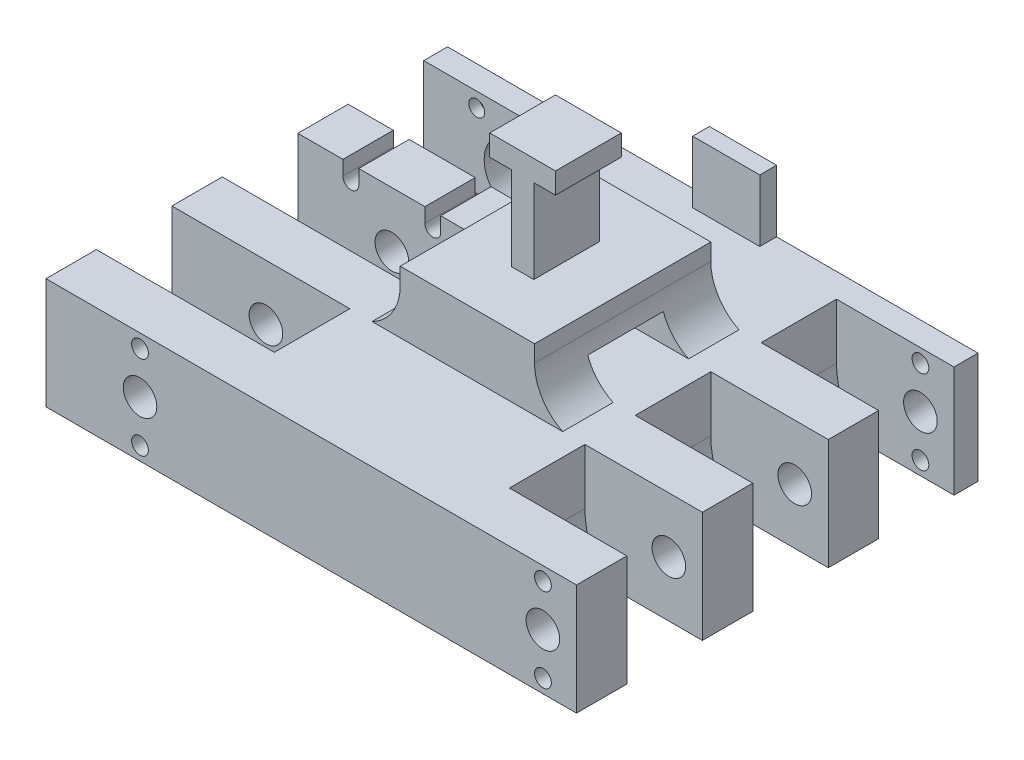
from build123d import *

# Parameters (mm, degrees)
BOSS_EXTRUDE1_DEPTH            = 38.1
CUT_EXTRUDE1_DEPTH             = 164.257993679
CUT_EXTRUDE1_DEPTH_BACK        = 254
SKETCH2_R                      = 6.35
SKETCH12_W                     = 50.8
SKETCH12_H                     = 19.05
BOSS_EXTRUDE6_DEPTH            = 12.7
SKETCH13_W                     = 50.8
SKETCH13_H                     = 66.675
BOSS_EXTRUDE7_DEPTH            = 12.7
SKETCH5_W                      = 8.466666666
SKETCH5_H                      = 24.892
BOSS_EXTRUDE8_DEPTH            = 31.75
SKETCH15_W                     = 24.892
SKETCH15_H                     = 24.892
BOSS_EXTRUDE9_DEPTH            = 7.9375
BOSS_EXTRUDE10_DEPTH           = 9
SKETCH17_3_R                   = 2
CUT_EXTRUDE2_DEPTH             = 206.205484286
SKETCH17_5_R                   = 2.999999969
SKETCH17_5_R_2                 = 2
CUT_EXTRUDE4_DEPTH             = 4
CUT_EXTRUDE4_DIRECTION_2_REACH = 207.205
SKETCH17_6_R                   = 12.7
CUT_EXTRUDE5_DEPTH             = 206.205484286
SKETCH18_W                     = 5.999999938
SKETCH18_H                     = 3.55
CUT_EXTRUDE6_DEPTH             = 19.05
SKETCH19_W                     = 254
SKETCH19_H                     = 38.1
BOSS_EXTRUDE11_DEPTH           = 19.05
SKETCH2_4_R                    = 6.35
CUT_EXTRUDE7_DEPTH             = 195.02247977
FILLET4_R                      = 19.05
CHAMFER1_SIZE                  = 2.032
FILLET1_R                      = 6.35
SKETCH28_W                     = 254
SKETCH28_H                     = 19.05
BOSS_EXTRUDE15_DEPTH           = 1.95
SKETCH30_W                     = 254
SKETCH30_H                     = 19.05
BOSS_EXTRUDE18_DEPTH           = 1.95
SKETCH20_R                     = 3.175
CUT_EXTRUDE8_DEPTH             = 9.525
SKETCH23_W                     = 9.082
SKETCH23_H                     = 42
BOSS_EXTRUDE12_DEPTH           = 101.6
SKETCH22_R                     = 3.175
CUT_EXTRUDE9_DEPTH             = 9.525
SKETCH2_5_R                    = 6.35
CUT_EXTRUDE10_DEPTH            = 104.25
FILLET2_R                      = 6.35
SKETCH25_W                     = 9
SKETCH25_H                     = 42
BOSS_EXTRUDE13_DEPTH           = 29.8
BOSS_EXTRUDE19_REACH           = 212.758
SKETCH32_W                     = 32.300000031
SKETCH32_H                     = 19.05
SKETCH32_W_2                   = 25.000000062
SKETCH32_W_3                   = 13.250000031
SKETCH32_W_4                   = 82.55
BOSS_EXTRUDE20_DEPTH           = 1.95
SKETCH36_W                     = 254
SKETCH36_H                     = 19.05
SKETCH36_W_2                   = 184.700000031
SKETCH36_W_3                   = 32.300000031
SKETCH36_W_4                   = 25.000000062
BOSS_EXTRUDE26_DEPTH           = 1.95
SKETCH37_W                     = 19.05
SKETCH37_H                     = 42
SKETCH37_W_2                   = 9.082
CUT_EXTRUDE11_DEPTH            = 38.1
SKETCH39_W                     = 9
SKETCH39_H                     = 42
SKETCH39_W_2                   = 19.05
CUT_EXTRUDE12_DEPTH            = 15.24
SKETCH40_W                     = 25.4
SKETCH40_H                     = 6.35
BOSS_EXTRUDE27_DEPTH           = 23.45


with BuildPart() as part:
    # Sketch1 → Boss-Extrude1 (new body)
    with BuildSketch(Plane(origin=(0, 0, 0), x_dir=(1, 0, 0), z_dir=(0, 1, 0))):
        Polygon((-25.4, 0), (-25.4, 28.575), (-127, 28.575), (-127, 47.625), (-25.4, 47.625), (-25.4, 76.2), (-127, 76.2), (-127, 95.25), (-25.4, 95.25), (-25.4, 123.825), (25.4, 123.825), (25.4, 95.25), (127, 95.25), (127, 76.2), (25.4, 76.2), (25.4, 47.625), (127, 47.625), (127, 28.575), (25.4, 28.575), (25.4, 0), align=None)
    extrude(amount=BOSS_EXTRUDE1_DEPTH)

    # Sketch2 → Cut-Extrude1 (cut, two sides: drawn at the far end of the back side and taken through both)
    with BuildSketch(Plane.XY.offset(-28.575).offset(-CUT_EXTRUDE1_DEPTH_BACK)):
        with Locations(Location((-76.2, 19.05, 0), (0, 0, 180))):
            Circle(SKETCH2_R)
        with Locations(Location((76.2, 19.05, 0), (0, 0, 180))):
            Circle(SKETCH2_R)
    extrude(amount=CUT_EXTRUDE1_DEPTH + CUT_EXTRUDE1_DEPTH_BACK, mode=Mode.SUBTRACT)

    # Sketch12 → Boss-Extrude6 (add)
    with BuildSketch(Plane(origin=(0, 38.1, 0), x_dir=(1, 0, 0), z_dir=(0, 1, 0))):
        with Locations((0, 38.1)):
            Rectangle(SKETCH12_W, SKETCH12_H)
        with Locations((0, 85.725)):
            Rectangle(SKETCH12_W, SKETCH12_H)
    extrude(amount=BOSS_EXTRUDE6_DEPTH)

    # Sketch13 → Boss-Extrude7 (add)
    with BuildSketch(Plane(origin=(0, 50.8, 0), x_dir=(1, 0, 0), z_dir=(0, 1, 0))):
        with Locations((0, 61.9125)):
            Rectangle(SKETCH13_W, SKETCH13_H)
    extrude(amount=BOSS_EXTRUDE7_DEPTH)

    # Sketch5 → Boss-Extrude8 (add)
    with BuildSketch(Plane(origin=(0, 63.5, 0), x_dir=(1, 0, 0), z_dir=(0, 1, 0))):
        with Locations((0, 61.9125)):
            Rectangle(SKETCH5_W, SKETCH5_H)
    extrude(amount=BOSS_EXTRUDE8_DEPTH)

    # Sketch15 → Boss-Extrude9 (add)
    with BuildSketch(Plane(origin=(0, 95.25, 0), x_dir=(1, 0, 0), z_dir=(0, 1, 0))):
        with Locations((0, 61.9125)):
            Rectangle(SKETCH15_W, SKETCH15_H)
    extrude(amount=BOSS_EXTRUDE9_DEPTH)

    # Sketch17 → Boss-Extrude10 (add)
    with BuildSketch(Plane(origin=(0, 0, -123.825), x_dir=(-1, 0, 0), z_dir=(0, 0, -1))):
        Polygon((55.2, -1.95), (-25.4, -1.95), (-25.4, 40.05), (55.2, 40.05), (97.2, 40.05), (97.2, -1.95), align=None)
    extrude(amount=BOSS_EXTRUDE10_DEPTH)

    # Sketch17<3> → Cut-Extrude2 (cut, through all)
    with BuildSketch(Plane(origin=(0, 0, -123.825), x_dir=(-1, 0, 0), z_dir=(0, 0, -1))):
        with Locations((91.7, 3.55)):
            Circle(SKETCH17_3_R)
        with Locations((60.7, 3.55)):
            Circle(SKETCH17_3_R)
        with Locations((60.7, 34.55)):
            Circle(SKETCH17_3_R)
        with Locations((91.7, 34.55)):
            Circle(SKETCH17_3_R)
    extrude(amount=CUT_EXTRUDE2_DEPTH, mode=Mode.SUBTRACT)

    # Sketch17<5> → Cut-Extrude4 (cut)
    # profile 1 of 4: a face of its own
    with BuildSketch(Plane(origin=(0, 0, -123.825), x_dir=(-1, 0, 0), z_dir=(0, 0, -1))):
        with Locations((91.7, 3.55)):
            Circle(SKETCH17_5_R)
        with Locations((91.7, 3.55)):
            Circle(SKETCH17_5_R_2, mode=Mode.SUBTRACT)
    # profile 2 of 4: a face of its own
    with BuildSketch(Plane(origin=(0, 0, -123.825), x_dir=(-1, 0, 0), z_dir=(0, 0, -1))):
        with Locations((91.7, 34.55)):
            Circle(SKETCH17_5_R)
    # profile 3 of 4: a face of its own
    with BuildSketch(Plane(origin=(0, 0, -123.825), x_dir=(-1, 0, 0), z_dir=(0, 0, -1))):
        with Locations((60.7, 34.55)):
            Circle(SKETCH17_5_R)
    # profile 4 of 4: a face of its own
    with BuildSketch(Plane(origin=(0, 0, -123.825), x_dir=(-1, 0, 0), z_dir=(0, 0, -1))):
        with Locations((60.7, 3.55)):
            Circle(SKETCH17_5_R)
    extrude(amount=CUT_EXTRUDE4_DEPTH, mode=Mode.SUBTRACT)

    # Cut-Extrude4 direction 2: up to this face of the body (flat: up to its plane)
    cut_extrude4_direction_2_end = Plane(part.part.faces().sort_by_distance((-26.485088476, 19.05, -76.2))[0])
    # Sketch17<5> → Cut-Extrude4 direction 2 (cut, up to the picked face)
    with BuildSketch(Plane(origin=(0, 0, -123.825), x_dir=(-1, 0, 0), z_dir=(0, 0, -1)), mode=Mode.PRIVATE) as cut_extrude4_direction_2_sk1:
        with Locations((91.7, 3.55)):
            Circle(SKETCH17_5_R)
        with Locations((91.7, 3.55)):
            Circle(SKETCH17_5_R_2, mode=Mode.SUBTRACT)
    cut_extrude4_direction_2_tool1 = split(extrude(cut_extrude4_direction_2_sk1.sketch, amount=-CUT_EXTRUDE4_DIRECTION_2_REACH, mode=Mode.PRIVATE), bisect_by=cut_extrude4_direction_2_end, keep=Keep.BOTH, mode=Mode.PRIVATE)
    # Sketch17<5> → Cut-Extrude4 direction 2 (cut, up to the picked face)
    with BuildSketch(Plane(origin=(0, 0, -123.825), x_dir=(-1, 0, 0), z_dir=(0, 0, -1)), mode=Mode.PRIVATE) as cut_extrude4_direction_2_sk2:
        with Locations((91.7, 34.55)):
            Circle(SKETCH17_5_R)
    cut_extrude4_direction_2_tool2 = split(extrude(cut_extrude4_direction_2_sk2.sketch, amount=-CUT_EXTRUDE4_DIRECTION_2_REACH, mode=Mode.PRIVATE), bisect_by=cut_extrude4_direction_2_end, keep=Keep.BOTH, mode=Mode.PRIVATE)
    # Sketch17<5> → Cut-Extrude4 direction 2 (cut, up to the picked face)
    with BuildSketch(Plane(origin=(0, 0, -123.825), x_dir=(-1, 0, 0), z_dir=(0, 0, -1)), mode=Mode.PRIVATE) as cut_extrude4_direction_2_sk3:
        with Locations((60.7, 34.55)):
            Circle(SKETCH17_5_R)
    cut_extrude4_direction_2_tool3 = split(extrude(cut_extrude4_direction_2_sk3.sketch, amount=-CUT_EXTRUDE4_DIRECTION_2_REACH, mode=Mode.PRIVATE), bisect_by=cut_extrude4_direction_2_end, keep=Keep.BOTH, mode=Mode.PRIVATE)
    # Sketch17<5> → Cut-Extrude4 direction 2 (cut, up to the picked face)
    with BuildSketch(Plane(origin=(0, 0, -123.825), x_dir=(-1, 0, 0), z_dir=(0, 0, -1)), mode=Mode.PRIVATE) as cut_extrude4_direction_2_sk4:
        with Locations((60.7, 3.55)):
            Circle(SKETCH17_5_R)
    cut_extrude4_direction_2_tool4 = split(extrude(cut_extrude4_direction_2_sk4.sketch, amount=-CUT_EXTRUDE4_DIRECTION_2_REACH, mode=Mode.PRIVATE), bisect_by=cut_extrude4_direction_2_end, keep=Keep.BOTH, mode=Mode.PRIVATE)
    add(cut_extrude4_direction_2_tool1.solids().sort_by(Axis((-88.784853, 3.55, -123.825), (0, 0, 1)))[0], mode=Mode.SUBTRACT)
    add(cut_extrude4_direction_2_tool2.solids().sort_by(Axis((-91.7, 34.55, -123.825), (0, 0, 1)))[0], mode=Mode.SUBTRACT)
    add(cut_extrude4_direction_2_tool3.solids().sort_by(Axis((-60.7, 34.55, -123.825), (0, 0, 1)))[0], mode=Mode.SUBTRACT)
    add(cut_extrude4_direction_2_tool4.solids().sort_by(Axis((-60.7, 3.55, -123.825), (0, 0, 1)))[0], mode=Mode.SUBTRACT)


with BuildPart() as cut_extrude4_kept_piece:
    # of the separate pieces the step leaves, the one the design keeps (cut_extrude4_pieces_kept)
    add(part.part.solids().sort_by_distance((25.4, -1.95, -123.825))[0])

    # Sketch17<6> → Cut-Extrude5 (cut, through all)
    with BuildSketch(Plane(origin=(0, 0, -123.825), x_dir=(-1, 0, 0), z_dir=(0, 0, -1))):
        with Locations((76.2, 19.05)):
            Circle(SKETCH17_6_R)
    extrude(amount=CUT_EXTRUDE5_DEPTH, mode=Mode.SUBTRACT)

    # Sketch18 → Cut-Extrude6 (cut)
    with BuildSketch(Plane.XY.offset(-76.2)):
        with Locations((-91.7, 36.325)):
            Rectangle(SKETCH18_W, SKETCH18_H)
        with Locations((-60.7, 36.325)):
            Rectangle(SKETCH18_W, SKETCH18_H)
        with Locations((-91.7, 1.775)):
            Rectangle(SKETCH18_W, SKETCH18_H)
        with Locations((-60.7, 1.775)):
            Rectangle(SKETCH18_W, SKETCH18_H)
    extrude(amount=-CUT_EXTRUDE6_DEPTH, mode=Mode.SUBTRACT)

    # Sketch19 → Boss-Extrude11 (add)
    with BuildSketch(Plane.XY):
        with Locations((0, 19.05)):
            Rectangle(SKETCH19_W, SKETCH19_H)
    extrude(amount=BOSS_EXTRUDE11_DEPTH)

    # Sketch2<4> → Cut-Extrude7 (cut, through all)
    with BuildSketch(Plane.XY.offset(-28.575)):
        with Locations(Location((-76.2, 19.05, 0), (0, 0, 180))):
            Circle(SKETCH2_4_R)
        with Locations(Location((76.2, 19.05, 0), (0, 0, 180))):
            Circle(SKETCH2_4_R)
    extrude(amount=CUT_EXTRUDE7_DEPTH, mode=Mode.SUBTRACT)

    # Fillet4
    # the kernel refuses this fillet: 19.05 mm, written as the material it adds along each edge
    with BuildSketch(Plane(origin=(25.4, 38.1, -95.25), x_dir=(0, 1, 0), z_dir=(0, 0, 1))) as fillet4_piece_1_section:
        with BuildLine():
            CenterArc((FILLET4_R, -FILLET4_R), FILLET4_R, 90, 90)
            Line((0, -FILLET4_R), (0, 0))
            Line((0, 0), (FILLET4_R, 0))
        make_face()
    fillet4_piece_1 = extrude(amount=66.675, mode=Mode.PRIVATE)
    fillet4_piece_1 = split(fillet4_piece_1, bisect_by=Plane(origin=(25.459639718, 50.8, -85.725), z_dir=(0, 1, 0)), keep=Keep.TOP, mode=Mode.PRIVATE)
    fillet4_piece_1 = split(fillet4_piece_1, bisect_by=Plane(origin=(25.459639718, 53.200481038, -76.2), z_dir=(0, 0, -1)), keep=Keep.TOP, mode=Mode.PRIVATE)
    add(fillet4_piece_1)
    with BuildSketch(Plane(origin=(25.4, 38.1, -95.25), x_dir=(0, 1, 0), z_dir=(0, 0, 1))) as fillet4_piece_2_section:
        with BuildLine():
            CenterArc((FILLET4_R, -FILLET4_R), FILLET4_R, 90, 90)
            Line((0, -FILLET4_R), (0, 0))
            Line((0, 0), (FILLET4_R, 0))
        make_face()
    fillet4_piece_2 = extrude(amount=66.675, mode=Mode.PRIVATE)
    fillet4_piece_2 = split(fillet4_piece_2, bisect_by=Plane(origin=(29.940315432, 50.8, -85.725), z_dir=(0, -1, 0)), keep=Keep.TOP, mode=Mode.PRIVATE)
    fillet4_piece_2 = split(fillet4_piece_2, bisect_by=Plane(origin=(29.940315432, 41.835832031, -76.2), z_dir=(0, 0, -1)), keep=Keep.TOP, mode=Mode.PRIVATE)
    add(fillet4_piece_2)
    with BuildSketch(Plane(origin=(25.4, 38.1, -95.25), x_dir=(0, 1, 0), z_dir=(0, 0, 1))) as fillet4_piece_3_section:
        with BuildLine():
            CenterArc((FILLET4_R, -FILLET4_R), FILLET4_R, 90, 90)
            Line((0, -FILLET4_R), (0, 0))
            Line((0, 0), (FILLET4_R, 0))
        make_face()
    fillet4_piece_3 = extrude(amount=66.675, mode=Mode.PRIVATE)
    fillet4_piece_3 = split(fillet4_piece_3, bisect_by=Plane(origin=(25.459639718, 53.200481038, -47.625), z_dir=(0, 0, -1)), keep=Keep.TOP, mode=Mode.PRIVATE)
    fillet4_piece_3 = split(fillet4_piece_3, bisect_by=Plane(origin=(25.459639718, 50.8, -61.9125), z_dir=(0, 1, 0)), keep=Keep.TOP, mode=Mode.PRIVATE)
    fillet4_piece_3 = split(fillet4_piece_3, bisect_by=Plane(origin=(25.459639718, 53.200481038, -76.2), z_dir=(0, 0, 1)), keep=Keep.TOP, mode=Mode.PRIVATE)
    add(fillet4_piece_3)
    with BuildSketch(Plane(origin=(25.4, 38.1, -47.625), x_dir=(0, 1, 0), z_dir=(0, 0, 1))) as fillet4_piece_4_section:
        with BuildLine():
            CenterArc((FILLET4_R, -FILLET4_R), FILLET4_R, 90, 90)
            Line((0, -FILLET4_R), (0, 0))
            Line((0, 0), (FILLET4_R, 0))
        make_face()
    fillet4_piece_4 = extrude(amount=19.05, mode=Mode.PRIVATE)
    fillet4_piece_4 = split(fillet4_piece_4, bisect_by=Plane(origin=(25.459639718, 50.8, -38.1), z_dir=(0, 1, 0)), keep=Keep.TOP, mode=Mode.PRIVATE)
    add(fillet4_piece_4)
    with BuildSketch(Plane(origin=(25.4, 38.1, -47.625), x_dir=(0, 1, 0), z_dir=(0, 0, 1))) as fillet4_piece_5_section:
        with BuildLine():
            CenterArc((FILLET4_R, -FILLET4_R), FILLET4_R, 90, 90)
            Line((0, -FILLET4_R), (0, 0))
            Line((0, 0), (FILLET4_R, 0))
        make_face()
    fillet4_piece_5 = extrude(amount=19.05, mode=Mode.PRIVATE)
    fillet4_piece_5 = split(fillet4_piece_5, bisect_by=Plane(origin=(29.940315432, 50.8, -38.1), z_dir=(0, -1, 0)), keep=Keep.TOP, mode=Mode.PRIVATE)
    add(fillet4_piece_5)
    with BuildSketch(Plane(origin=(-25.4, 38.1, -28.575), x_dir=(0, 1, 0), z_dir=(0, 0, -1))) as fillet4_piece_6_section:
        with BuildLine():
            CenterArc((FILLET4_R, -FILLET4_R), FILLET4_R, 90, 90)
            Line((0, -FILLET4_R), (0, 0))
            Line((0, 0), (FILLET4_R, 0))
        make_face()
    fillet4_piece_6 = extrude(amount=66.675, mode=Mode.PRIVATE)
    fillet4_piece_6 = split(fillet4_piece_6, bisect_by=Plane(origin=(-25.459639718, 50.8, -38.1), z_dir=(0, 1, 0)), keep=Keep.TOP, mode=Mode.PRIVATE)
    fillet4_piece_6 = split(fillet4_piece_6, bisect_by=Plane(origin=(-25.459639718, 53.200481038, -47.625), z_dir=(0, 0, 1)), keep=Keep.TOP, mode=Mode.PRIVATE)
    add(fillet4_piece_6)
    with BuildSketch(Plane(origin=(-25.4, 38.1, -28.575), x_dir=(0, 1, 0), z_dir=(0, 0, -1))) as fillet4_piece_7_section:
        with BuildLine():
            CenterArc((FILLET4_R, -FILLET4_R), FILLET4_R, 90, 90)
            Line((0, -FILLET4_R), (0, 0))
            Line((0, 0), (FILLET4_R, 0))
        make_face()
    fillet4_piece_7 = extrude(amount=66.675, mode=Mode.PRIVATE)
    fillet4_piece_7 = split(fillet4_piece_7, bisect_by=Plane(origin=(-29.940315432, 50.8, -38.1), z_dir=(0, -1, 0)), keep=Keep.TOP, mode=Mode.PRIVATE)
    fillet4_piece_7 = split(fillet4_piece_7, bisect_by=Plane(origin=(-29.940315432, 41.835832031, -47.625), z_dir=(0, 0, 1)), keep=Keep.TOP, mode=Mode.PRIVATE)
    add(fillet4_piece_7)
    with BuildSketch(Plane(origin=(-25.4, 38.1, -28.575), x_dir=(0, 1, 0), z_dir=(0, 0, -1))) as fillet4_piece_8_section:
        with BuildLine():
            CenterArc((FILLET4_R, -FILLET4_R), FILLET4_R, 90, 90)
            Line((0, -FILLET4_R), (0, 0))
            Line((0, 0), (FILLET4_R, 0))
        make_face()
    fillet4_piece_8 = extrude(amount=66.675, mode=Mode.PRIVATE)
    fillet4_piece_8 = split(fillet4_piece_8, bisect_by=Plane(origin=(-25.459639718, 53.200481038, -76.2), z_dir=(0, 0, 1)), keep=Keep.TOP, mode=Mode.PRIVATE)
    fillet4_piece_8 = split(fillet4_piece_8, bisect_by=Plane(origin=(-25.459639718, 50.8, -61.9125), z_dir=(0, 1, 0)), keep=Keep.TOP, mode=Mode.PRIVATE)
    fillet4_piece_8 = split(fillet4_piece_8, bisect_by=Plane(origin=(-25.459639718, 53.200481038, -47.625), z_dir=(0, 0, -1)), keep=Keep.TOP, mode=Mode.PRIVATE)
    add(fillet4_piece_8)
    with BuildSketch(Plane(origin=(-25.4, 38.1, -76.2), x_dir=(0, 1, 0), z_dir=(0, 0, -1))) as fillet4_piece_9_section:
        with BuildLine():
            CenterArc((FILLET4_R, -FILLET4_R), FILLET4_R, 90, 90)
            Line((0, -FILLET4_R), (0, 0))
            Line((0, 0), (FILLET4_R, 0))
        make_face()
    fillet4_piece_9 = extrude(amount=19.05, mode=Mode.PRIVATE)
    fillet4_piece_9 = split(fillet4_piece_9, bisect_by=Plane(origin=(-25.459639718, 50.8, -85.725), z_dir=(0, 1, 0)), keep=Keep.TOP, mode=Mode.PRIVATE)
    add(fillet4_piece_9)
    with BuildSketch(Plane(origin=(-25.4, 38.1, -76.2), x_dir=(0, 1, 0), z_dir=(0, 0, -1))) as fillet4_piece_10_section:
        with BuildLine():
            CenterArc((FILLET4_R, -FILLET4_R), FILLET4_R, 90, 90)
            Line((0, -FILLET4_R), (0, 0))
            Line((0, 0), (FILLET4_R, 0))
        make_face()
    fillet4_piece_10 = extrude(amount=19.05, mode=Mode.PRIVATE)
    fillet4_piece_10 = split(fillet4_piece_10, bisect_by=Plane(origin=(-29.940315432, 50.8, -85.725), z_dir=(0, -1, 0)), keep=Keep.TOP, mode=Mode.PRIVATE)
    add(fillet4_piece_10)

    # Chamfer1
    # the kernel refuses this chamfer: 2.032 mm, written as the material it adds along each edge
    with BuildSketch(Plane(origin=(-25.4, 0, -123.825), x_dir=(0, 0.027495876610586417, 0.9996219169112968), z_dir=(1, 0, 0))) as chamfer1_piece_1_section:
        Polygon((CHAMFER1_SIZE * 0.999621916911, CHAMFER1_SIZE * 0.0274958766106), (-CHAMFER1_SIZE * 0.0274958766106, CHAMFER1_SIZE * 0.999621916911), (0, 0), align=None)
    chamfer1_piece_1 = extrude(amount=50.8, mode=Mode.PRIVATE)
    chamfer1_piece_1 = split(chamfer1_piece_1, bisect_by=Plane(origin=(0, -1.95, -123.150310434), z_dir=(0, 1, 0)), keep=Keep.TOP, mode=Mode.PRIVATE)
    add(chamfer1_piece_1)
    with BuildSketch(Plane(origin=(-25.4, 38.1, -123.825), x_dir=(0, -0.027495876610587305, 0.9996219169112968), z_dir=(1, 0, 0))) as chamfer1_piece_2_section:
        Polygon((CHAMFER1_SIZE * 0.999621916911, -CHAMFER1_SIZE * 0.0274958766106), (-CHAMFER1_SIZE * 0.0274958766106, -CHAMFER1_SIZE * 0.999621916911), (0, 0), align=None)
    chamfer1_piece_2 = extrude(amount=50.8, mode=Mode.PRIVATE)
    chamfer1_piece_2 = split(chamfer1_piece_2, bisect_by=Plane(origin=(0, 40.05, -123.150310434), z_dir=(0, -1, 0)), keep=Keep.TOP, mode=Mode.PRIVATE)
    add(chamfer1_piece_2)

    # Fillet1
    fillet1_edges = [cut_extrude4_kept_piece.edges().sort_by_distance(p)[0] for p in [
        (-25.4, 19.05, -123.825),
    ]]
    fillet(fillet1_edges, radius=FILLET1_R)

    # Sketch28 → Boss-Extrude15 (add)
    with BuildSketch(Plane(origin=(0, 38.1, 0), x_dir=(1, 0, 0), z_dir=(0, 1, 0))):
        with Locations((0, -9.525)):
            Rectangle(SKETCH28_W, SKETCH28_H)
    extrude(amount=BOSS_EXTRUDE15_DEPTH)

    # Sketch30 → Boss-Extrude18 (add)
    with BuildSketch(Plane.XZ):
        with Locations((0, 9.525)):
            Rectangle(SKETCH30_W, SKETCH30_H)
    extrude(amount=BOSS_EXTRUDE18_DEPTH)

    # Sketch20 → Cut-Extrude8 (cut)
    with BuildSketch(Plane.XY.offset(19.05)):
        with Locations((76.2, 3.175)):
            Circle(SKETCH20_R)
        with Locations((76.2, 34.925)):
            Circle(SKETCH20_R)
    cut_extrude8 = extrude(amount=-CUT_EXTRUDE8_DEPTH, mode=Mode.SUBTRACT)

    # Mirror1: Cut-Extrude8 across plane
    add(cut_extrude8.mirror(Plane(origin=(0, 0, 0), x_dir=(0, 0, 1), z_dir=(1, 0, 0))), mode=Mode.SUBTRACT)

    # Sketch23 → Boss-Extrude12 (add)
    with BuildSketch(Plane(origin=(25.4, 0, 0), x_dir=(0, 0, -1), z_dir=(1, 0, 0))):
        with Locations((128.284, 19.05)):
            Rectangle(SKETCH23_W, SKETCH23_H)
    extrude(amount=BOSS_EXTRUDE12_DEPTH)

    # Sketch22 → Cut-Extrude9 (cut)
    with BuildSketch(Plane(origin=(0, 0, -132.825), x_dir=(-1, 0, 0), z_dir=(0, 0, -1))):
        with Locations(Location((-76.2, 3.175, 0), (0, 0, 180))):
            Circle(SKETCH22_R)
        with Locations(Location((-76.2, 34.925, 0), (0, 0, 180))):
            Circle(SKETCH22_R)
    extrude(amount=-CUT_EXTRUDE9_DEPTH, mode=Mode.SUBTRACT)

    # Sketch2<5> → Cut-Extrude10 (cut)
    with BuildSketch(Plane.XY.offset(-28.575)):
        with Locations(Location((-76.2, 19.05, 0), (0, 0, 180))):
            Circle(SKETCH2_5_R)
        with Locations(Location((76.2, 19.05, 0), (0, 0, 180))):
            Circle(SKETCH2_5_R)
    extrude(amount=-CUT_EXTRUDE10_DEPTH, mode=Mode.SUBTRACT)

    # Fillet2
    # the kernel refuses this fillet: 6.35 mm, written as the material it adds along each edge
    with BuildSketch(Plane(origin=(25.4, 0, -95.25), x_dir=(0, 0, -1), z_dir=(0, 1, 0)), Plane(origin=(25.4, 0, -76.2), x_dir=(1, 0, 0), z_dir=(0, 1, 0)), Plane(origin=(25.4, 0, -28.575), x_dir=(1, 0, 0), z_dir=(0, 1, 0))) as fillet2_piece_1:
        with BuildLine():
            CenterArc((FILLET2_R, -FILLET2_R), FILLET2_R, 90, 90)
            Line((0, -FILLET2_R), (0, 0))
            Line((0, 0), (FILLET2_R, 0))
        make_face()
    extrude(amount=38.1)
    with BuildSketch(Plane(origin=(25.4, 0, -47.625), x_dir=(1, 0, 0), z_dir=(0, 1, 0)), Plane(origin=(-25.4, 0, -28.575), x_dir=(-1, 0, 0), z_dir=(0, 1, 0)), Plane(origin=(-25.4, 0, -47.625), x_dir=(0, 0, -1), z_dir=(0, 1, 0)), Plane(origin=(-25.4, 0, -76.2), x_dir=(-1, 0, 0), z_dir=(0, 1, 0)), Plane(origin=(-25.4, 0, -95.25), x_dir=(0, 0, -1), z_dir=(0, 1, 0)), Plane(origin=(25.4, 0, 0), x_dir=(1, 0, 0), z_dir=(0, 1, 0)), Plane(origin=(-25.4, 0, 0), x_dir=(0, 0, -1), z_dir=(0, 1, 0))) as fillet2_piece_2:
        with BuildLine():
            CenterArc((FILLET2_R, FILLET2_R), FILLET2_R, 180, 90)
            Line((0, FILLET2_R), (0, 0))
            Line((0, 0), (FILLET2_R, 0))
        make_face()
    extrude(amount=38.1)
    with BuildSketch(Plane(origin=(25.4, 40.05, -123.743), x_dir=(0, 0, 1), z_dir=(0, -1, 0))) as fillet2_piece_3_section:
        with BuildLine():
            CenterArc((FILLET2_R, -FILLET2_R), FILLET2_R, 90, 90)
            Line((0, -FILLET2_R), (0, 0))
            Line((0, 0), (FILLET2_R, 0))
        make_face()
    fillet2_piece_3 = extrude(amount=42, mode=Mode.PRIVATE)
    fillet2_piece_3 = split(fillet2_piece_3, bisect_by=Plane(origin=(27.566235429, 39.238692415, -122.931692415), z_dir=(0, -0.7071067811862648, -0.7071067811868302)), keep=Keep.TOP, mode=Mode.PRIVATE)
    fillet2_piece_3 = split(fillet2_piece_3, bisect_by=Plane(origin=(27.566235429, 38.1, -123.315011442), z_dir=(0, 1, 0)), keep=Keep.TOP, mode=Mode.PRIVATE)
    add(fillet2_piece_3)
    with BuildSketch(Plane(origin=(25.4, 40.05, -123.743), x_dir=(0, 0, 1), z_dir=(0, -1, 0))) as fillet2_piece_4_section:
        with BuildLine():
            CenterArc((FILLET2_R, -FILLET2_R), FILLET2_R, 90, 90)
            Line((0, -FILLET2_R), (0, 0))
            Line((0, 0), (FILLET2_R, 0))
        make_face()
    fillet2_piece_4 = extrude(amount=42, mode=Mode.PRIVATE)
    fillet2_piece_4 = split(fillet2_piece_4, bisect_by=Plane(origin=(25.606978645, 36.511918623, -120.204918623), z_dir=(0, 0.7071067811862648, 0.7071067811868302)), keep=Keep.TOP, mode=Mode.PRIVATE)
    fillet2_piece_4 = split(fillet2_piece_4, bisect_by=Plane(origin=(25.606978645, 38.1, -119.675558164), z_dir=(0, -1, 0)), keep=Keep.TOP, mode=Mode.PRIVATE)
    add(fillet2_piece_4)
    with BuildSketch(Plane(origin=(25.4, 40.05, -123.743), x_dir=(0, 0, 1), z_dir=(0, -1, 0))) as fillet2_piece_5_section:
        with BuildLine():
            CenterArc((FILLET2_R, -FILLET2_R), FILLET2_R, 90, 90)
            Line((0, -FILLET2_R), (0, 0))
            Line((0, 0), (FILLET2_R, 0))
        make_face()
    fillet2_piece_5 = extrude(amount=42, mode=Mode.PRIVATE)
    fillet2_piece_5 = split(fillet2_piece_5, bisect_by=Plane(origin=(26.862123467, 28.857389006, -112.550389006), z_dir=(0, -0.7071067811862648, -0.7071067811868302)), keep=Keep.TOP, mode=Mode.PRIVATE)
    fillet2_piece_5 = split(fillet2_piece_5, bisect_by=Plane(origin=(26.862123467, 38.1, -122.357778012), z_dir=(0, -1, 0)), keep=Keep.TOP, mode=Mode.PRIVATE)
    fillet2_piece_5 = split(fillet2_piece_5, bisect_by=Plane(origin=(26.862123467, 0, -122.357778012), z_dir=(0, 1, 0)), keep=Keep.TOP, mode=Mode.PRIVATE)
    fillet2_piece_5 = split(fillet2_piece_5, bisect_by=Plane(origin=(26.862123467, 9.242610994, -112.550389006), z_dir=(0, 0.7071067811862648, -0.7071067811868302)), keep=Keep.TOP, mode=Mode.PRIVATE)
    add(fillet2_piece_5)
    with BuildSketch(Plane(origin=(25.4, 40.05, -123.743), x_dir=(0, 0, 1), z_dir=(0, -1, 0))) as fillet2_piece_6_section:
        with BuildLine():
            CenterArc((FILLET2_R, -FILLET2_R), FILLET2_R, 90, 90)
            Line((0, -FILLET2_R), (0, 0))
            Line((0, 0), (FILLET2_R, 0))
        make_face()
    fillet2_piece_6 = extrude(amount=42, mode=Mode.PRIVATE)
    fillet2_piece_6 = split(fillet2_piece_6, bisect_by=Plane(origin=(27.566235429, 0, -123.315011442), z_dir=(0, -1, 0)), keep=Keep.TOP, mode=Mode.PRIVATE)
    fillet2_piece_6 = split(fillet2_piece_6, bisect_by=Plane(origin=(27.566235429, -1.138692415, -122.931692415), z_dir=(0, 0.7071067811862648, -0.7071067811868302)), keep=Keep.TOP, mode=Mode.PRIVATE)
    add(fillet2_piece_6)
    with BuildSketch(Plane(origin=(25.4, 40.05, -123.743), x_dir=(0, 0, 1), z_dir=(0, -1, 0))) as fillet2_piece_7_section:
        with BuildLine():
            CenterArc((FILLET2_R, -FILLET2_R), FILLET2_R, 90, 90)
            Line((0, -FILLET2_R), (0, 0))
            Line((0, 0), (FILLET2_R, 0))
        make_face()
    fillet2_piece_7 = extrude(amount=42, mode=Mode.PRIVATE)
    fillet2_piece_7 = split(fillet2_piece_7, bisect_by=Plane(origin=(25.606978645, 0, -119.675558164), z_dir=(0, 1, 0)), keep=Keep.TOP, mode=Mode.PRIVATE)
    fillet2_piece_7 = split(fillet2_piece_7, bisect_by=Plane(origin=(25.606978645, 1.588081377, -120.204918623), z_dir=(0, -0.7071067811862648, 0.7071067811868302)), keep=Keep.TOP, mode=Mode.PRIVATE)
    add(fillet2_piece_7)

    # Sketch25 → Boss-Extrude13 (add)
    with BuildSketch(Plane.ZY.offset(97.2)):
        with Locations((-128.325, 19.05)):
            Rectangle(SKETCH25_W, SKETCH25_H)
    extrude(amount=BOSS_EXTRUDE13_DEPTH)

    # Boss-Extrude19: up to this face of the body (flat: up to its plane)
    boss_extrude19_end = Plane(cut_extrude4_kept_piece.part.faces().sort_by_distance((2.818480031, 19.05, -132.825))[0])
    # Sketch26 → Boss-Extrude19 (add, up to the picked face)
    with BuildSketch(Plane(origin=(0, 0, 0), x_dir=(-1, 0, 0), z_dir=(0, 0, -1)), mode=Mode.PRIVATE) as boss_extrude19_sk1:
        with BuildLine():
            Line((-44.45, 40.05), (0, 40.05))
            Line((0, 40.05), (0, -1.95))
            Line((0, -1.95), (-52.38692586, -1.95))
            ThreePointArc((-52.38692586, -1.95), (-46.500441047, 7.825085834), (-44.45, 19.05))
            Line((-44.45, 19.05), (-44.45, 40.05))
        make_face()
    boss_extrude19_tool1 = split(extrude(boss_extrude19_sk1.sketch, amount=BOSS_EXTRUDE19_REACH, mode=Mode.PRIVATE), bisect_by=boss_extrude19_end, keep=Keep.BOTH, mode=Mode.PRIVATE)
    boss_extrude19 = boss_extrude19_tool1.solids().sort_by(Axis((22.895679, 18.6158, 0), (0, 0, -1)))[0]
    add(boss_extrude19)

    # Mirror2: Boss-Extrude19 across plane
    add(boss_extrude19.mirror(Plane(origin=(0, 0, 0), x_dir=(0, 0, 1), z_dir=(1, 0, 0))))

    # Sketch32 → Boss-Extrude20 (add)
    with BuildSketch(Plane(origin=(0, 38.1, 0), x_dir=(1, 0, 0), z_dir=(0, 1, 0))):
        with Locations((-110.849999985, 85.725)):
            Rectangle(SKETCH32_W, SKETCH32_H)
        with Locations((-76.2, 85.725)):
            Rectangle(SKETCH32_W_2, SKETCH32_H)
        with Locations((-51.075000016, 85.725)):
            Rectangle(SKETCH32_W_3, SKETCH32_H)
        with Locations((-85.725, 38.1)):
            Rectangle(SKETCH32_W_4, SKETCH32_H)
        with Locations((85.725, 38.1)):
            Rectangle(SKETCH32_W_4, SKETCH32_H)
        with Locations((85.725, 85.725)):
            Rectangle(SKETCH32_W_4, SKETCH32_H)
    extrude(amount=BOSS_EXTRUDE20_DEPTH)

    # Sketch36 → Boss-Extrude26 (add)
    with BuildSketch(Plane.XZ):
        with Locations((0, -38.1)):
            Rectangle(SKETCH36_W, SKETCH36_H)
        with Locations((34.649999985, -85.725)):
            Rectangle(SKETCH36_W_2, SKETCH36_H)
        with Locations((-110.849999985, -85.725)):
            Rectangle(SKETCH36_W_3, SKETCH36_H)
        with Locations((-76.2, -85.725)):
            Rectangle(SKETCH36_W_4, SKETCH36_H)
    extrude(amount=BOSS_EXTRUDE26_DEPTH)

    # Sketch37 → Cut-Extrude11 (cut)
    with BuildSketch(Plane(origin=(127, 0, 0), x_dir=(0, 0, -1), z_dir=(1, 0, 0))):
        with Locations((-9.525, 19.05)):
            Rectangle(SKETCH37_W, SKETCH37_H)
        with Locations((38.1, 19.05)):
            Rectangle(SKETCH37_W, SKETCH37_H)
        with Locations((85.725, 19.05)):
            Rectangle(SKETCH37_W, SKETCH37_H)
        with Locations((128.284, 19.05)):
            Rectangle(SKETCH37_W_2, SKETCH37_H)
    extrude(amount=-CUT_EXTRUDE11_DEPTH, mode=Mode.SUBTRACT)

    # Sketch39 → Cut-Extrude12 (cut)
    with BuildSketch(Plane.ZY.offset(127)):
        with Locations((-128.325, 19.05)):
            Rectangle(SKETCH39_W, SKETCH39_H)
        with Locations((-85.725, 19.05)):
            Rectangle(SKETCH39_W_2, SKETCH39_H)
        with Locations((-38.1, 19.05)):
            Rectangle(SKETCH39_W_2, SKETCH39_H)
        with Locations((9.525, 19.05)):
            Rectangle(SKETCH39_W_2, SKETCH39_H)
    extrude(amount=-CUT_EXTRUDE12_DEPTH, mode=Mode.SUBTRACT)

    # Sketch40 → Boss-Extrude27 (add)
    with BuildSketch(Plane(origin=(0, 40.05, 0), x_dir=(1, 0, 0), z_dir=(0, 1, 0))):
        with Locations((0, 129.65)):
            Rectangle(SKETCH40_W, SKETCH40_H)
    extrude(amount=BOSS_EXTRUDE27_DEPTH)


solid = cut_extrude4_kept_piece.part
